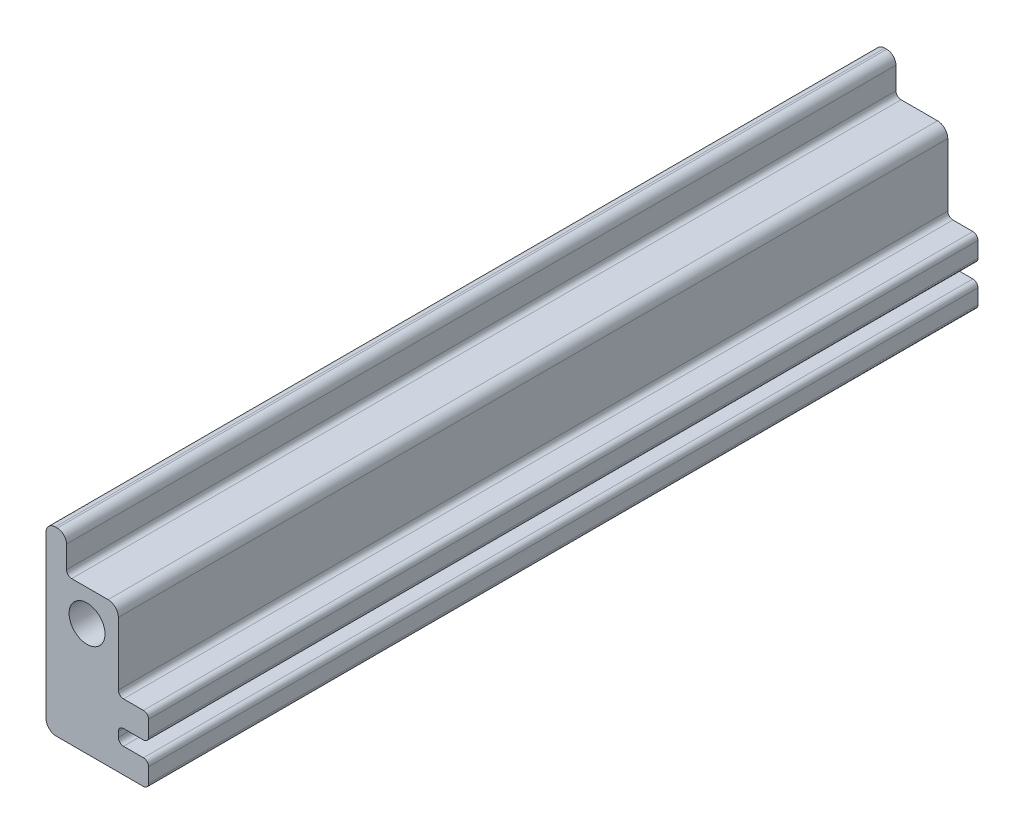
from build123d import *

# Parameters (mm, degrees)
SKETCH1_R           = 11.1125
BOSS_EXTRUDE1_DEPTH = 513.461


with BuildPart() as part:
    # Sketch1 → Boss-Extrude1 (new body)
    with BuildSketch(Plane.XY):
        with BuildLine():
            Line((34.925, -69.85), (-19.05, -69.85))
            ThreePointArc((-19.05, -69.85), (-23.540128061, -67.990128061), (-25.4, -63.5))
            Line((-25.4, -63.5), (-25.4, 36.297819962))
            ThreePointArc((-25.4, 36.297819962), (-23.726115254, 40.338935216), (-19.685, 42.012819962))
            Line((-19.685, 42.012819962), (-18.415, 42.012819962))
            ThreePointArc((-18.415, 42.012819962), (-14.373884746, 40.338935216), (-12.7, 36.297819962))
            Line((-12.7, 36.297819962), (-12.7, 22.56282))
            ThreePointArc((-12.7, 22.56282), (-11.77006403, 20.31775597), (-9.525, 19.38782))
            Line((-9.525, 19.38782), (13.03782, 19.38782))
            ThreePointArc((13.03782, 19.38782), (17.527948061, 17.527948061), (19.38782, 13.03782))
            Line((19.38782, 13.03782), (19.38782, -25.872179904))
            ThreePointArc((19.38782, -25.872179904), (20.31775597, -28.117243934), (22.56282, -29.047179904))
            Line((22.56282, -29.047179904), (34.925, -29.047179904))
            ThreePointArc((34.925, -29.047179904), (37.17006403, -29.977115874), (38.1, -32.222179904))
            Line((38.1, -32.222179904), (38.1, -41.747179904))
            ThreePointArc((38.1, -41.747179904), (37.17006403, -43.992243934), (34.925, -44.922179904))
            Line((34.925, -44.922179904), (22.56282, -44.922179904))
            ThreePointArc((22.56282, -44.922179904), (20.31775597, -45.852115874), (19.38782, -48.097179904))
            Line((19.38782, -48.097179904), (19.38782, -51.272179904))
            ThreePointArc((19.38782, -51.272179904), (20.31775597, -53.517243934), (22.56282, -54.447179904))
            Line((22.56282, -54.447179904), (34.925, -54.447179904))
            ThreePointArc((34.925, -54.447179904), (37.17006403, -55.377115874), (38.1, -57.622179904))
            Line((38.1, -57.622179904), (38.1, -66.675))
            ThreePointArc((38.1, -66.675), (37.17006403, -68.92006403), (34.925, -69.85))
        make_face()
        Circle(SKETCH1_R, mode=Mode.SUBTRACT)
    extrude(amount=BOSS_EXTRUDE1_DEPTH)


solid = part.part
